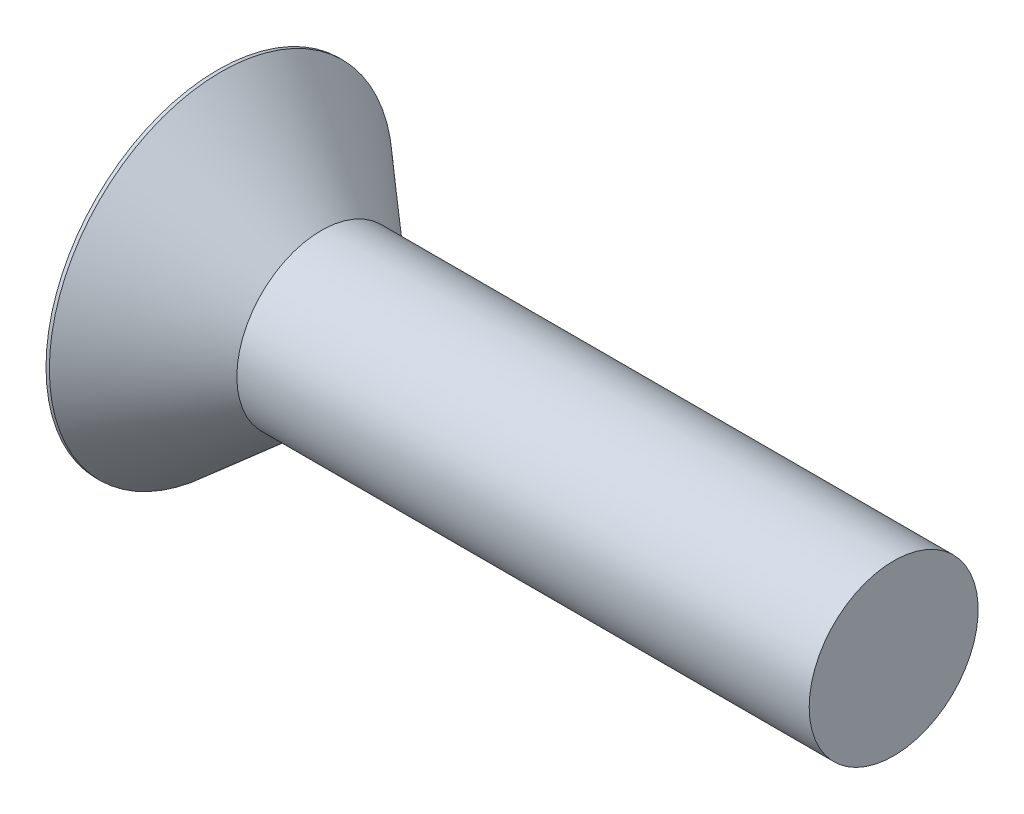
from build123d import *

# Parameters (mm, degrees)
CIRPATTERN1_COUNT = 2
CIRPATTERN1_ANGLE = 90


with BuildPart() as part:
    # BodySke → Base-Revolve (revolve)
    with BuildSketch(Plane.XY):
        Polygon((0, 0), (0, 9.6774), (0.188054315, 9.6774), (5.842, 4.7625), (38.1, 4.7625), (38.1, 0), align=None)
    revolve(axis=Axis((-6.35, 0, 0), (1, 0, 0)))

    # Sketch3 → Cross section 0
    with BuildSketch(Plane.ZY):
        with BuildLine():
            Line((-1.0922, 6.6421), (1.0922, 6.6421))
            Line((1.0922, 6.6421), (1.0922, -6.6421))
            Line((1.0922, -6.6421), (-1.0922, -6.6421))
            Line((-1.0922, -6.6421), (-1.0922, 6.6421))
        make_face()
    # Sketch4 → Cross section 1
    with BuildSketch(Plane.ZY.offset(-7.9756)):
        with BuildLine():
            Line((-0.5461, 0.5461), (0.5461, 0.5461))
            Line((0.5461, 0.5461), (0.5461, -0.5461))
            Line((0.5461, -0.5461), (-0.5461, -0.5461))
            Line((-0.5461, -0.5461), (-0.5461, 0.5461))
        make_face()
    cross = loft(mode=Mode.SUBTRACT)

    # CirPattern1: Cross ×2 about axis
    cirpattern1_axis = Axis((-6.35, 0, 0), (1, 0, 0))
    for i in range(1, CIRPATTERN1_COUNT):
        add(cross.rotate(cirpattern1_axis, i * CIRPATTERN1_ANGLE / (CIRPATTERN1_COUNT - 1)), mode=Mode.SUBTRACT)


solid = part.part
